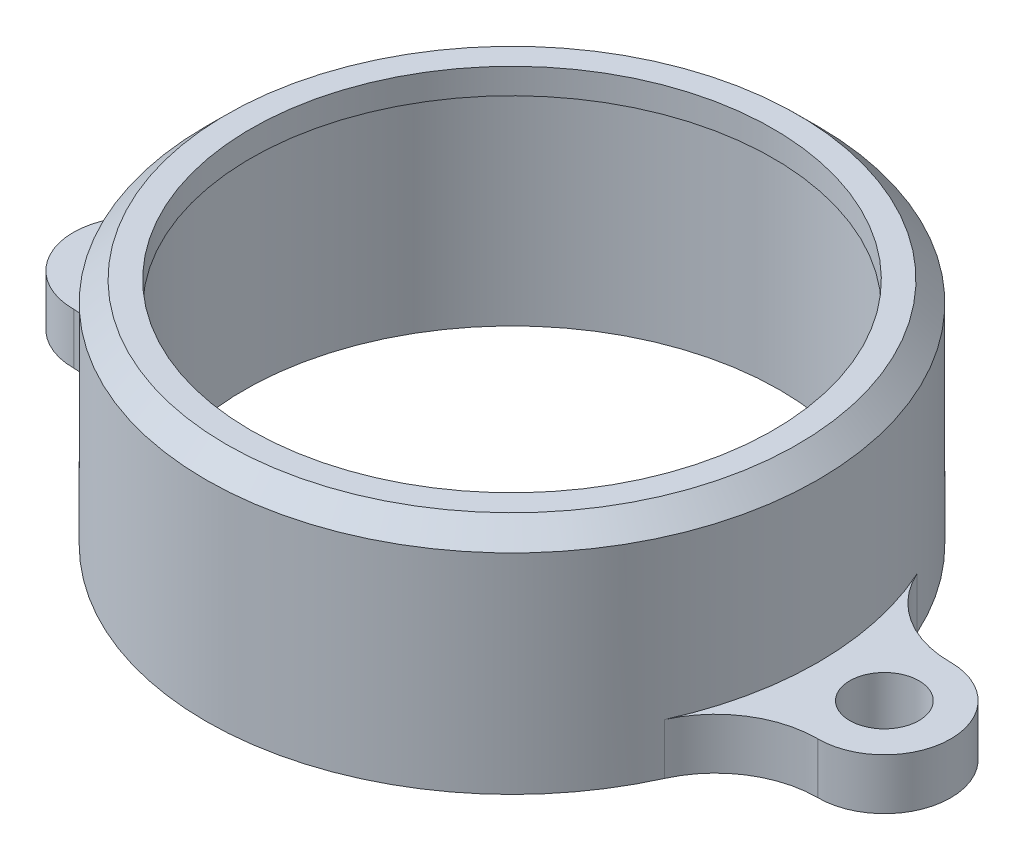
from build123d import *
from build123d.topology import SkipClean

# Parameters (mm, degrees)
SKETCH1_R             = 19.05
SKETCH1_R_2           = 16.256
BOSS_EXTRUDE1_DEPTH   = 1.5875
SKETCH2_R             = 19.05
SKETCH2_R_2           = 16.66875
BOSS_EXTRUDE2_DEPTH   = 9.525
CHAMFER1_SIZE         = 1.27
SKETCH3_R             = 16.66875
BOSS_EXTRUDE3_DEPTH   = 3.175
FILLET1_R             = 6.35
F_6_CLEARANCE_HOLE1_D = 4.3053


with BuildPart() as part:
    # Sketch1 → Boss-Extrude1 (new body)
    with BuildSketch(Plane(origin=(0, 0, 0), x_dir=(1, 0, 0), z_dir=(0, 1, 0))):
        with Locations(Location((0, 0, 0), (0, 0, 270))):
            Circle(SKETCH1_R)
        with Locations(Location((0, 0, 0), (0, 0, 270))):
            Circle(SKETCH1_R_2, mode=Mode.SUBTRACT)
    extrude(amount=-BOSS_EXTRUDE1_DEPTH)

    # Sketch2 → Boss-Extrude2 (add)
    with BuildSketch(Plane.XZ.offset(1.5875)):
        with Locations(Location((0, 0, 0), (0, 0, 90))):
            Circle(SKETCH2_R)
        with Locations(Location((0, 0, 0), (0, 0, 270))):
            Circle(SKETCH2_R_2, mode=Mode.SUBTRACT)
    extrude(amount=BOSS_EXTRUDE2_DEPTH)

    # Chamfer1
    chamfer1_edges = [part.edges().sort_by_distance(p)[0] for p in [
        (0, 0, -19.05),
    ]]
    chamfer(chamfer1_edges, length=CHAMFER1_SIZE)

    # Sketch3 → Boss-Extrude3 (add)
    with SkipClean():  # the faces are left unmerged after this step: merging them gives an invalid solid
        with BuildSketch(Plane.XZ.offset(11.1125)):
            with BuildLine():
                Line((-23.1775, 4.1275), (-18.5974795, 4.1275))
                ThreePointArc((-18.5974795, 4.1275), (0, 19.05), (18.5974795, 4.1275))
                Line((18.5974795, 4.1275), (23.1775, 4.1275))
                ThreePointArc((23.1775, 4.1275), (27.305, 0), (23.1775, -4.1275))
                Line((23.1775, -4.1275), (18.5974795, -4.1275))
                ThreePointArc((18.5974795, -4.1275), (0, -19.05), (-18.5974795, -4.1275))
                Line((-18.5974795, -4.1275), (-23.1775, -4.1275))
                ThreePointArc((-23.1775, -4.1275), (-27.305, 0), (-23.1775, 4.1275))
            make_face()
            with Locations(Location((0, 0, 0), (0, 0, 270))):
                Circle(SKETCH3_R, mode=Mode.SUBTRACT)
        extrude(amount=BOSS_EXTRUDE3_DEPTH)
    add(part.part.scale(1), mode=Mode.REPLACE)  # the faces are merged on a copy

    # Fillet1
    # the kernel refuses this fillet: 6.35 mm, written as the material it adds along each edge
    with BuildSketch(Plane(origin=(18.5974795, -11.1125, 4.1275), x_dir=(-0.3162725181456123, 0, 0.948668379501411), z_dir=(0, -1, 0)), Plane(origin=(-18.5974795, -11.1125, -4.1275), x_dir=(0.3162725181456131, 0, -0.9486683795014108), z_dir=(0, -1, 0))) as fillet1_piece_1:
        with BuildLine():
            CenterArc((4.587900184, -6.316085186), FILLET1_R, 95.924326289, 65.63802206)
            Line((-1.436144025, -4.307754696), (0, 0))
            ThreePointArc((0, 0), (1.966242936, -0.101744441), (3.932485872, 0))
        make_face()
    extrude(amount=3.175)
    with BuildSketch(Plane(origin=(-18.5974795, -11.1125, 4.1275), x_dir=(0.3162725181456136, 0, 0.9486683795014107), z_dir=(0, -1, 0)), Plane(origin=(18.5974795, -11.1125, -4.1275), x_dir=(-0.3162725181456148, 0, -0.9486683795014103), z_dir=(0, -1, 0))) as fillet1_piece_2:
        with BuildLine():
            CenterArc((4.587900184, 6.316085186), FILLET1_R, 198.437651651, 65.63802206)
            Line((-1.436144025, 4.307754696), (0, 0))
            ThreePointArc((0, 0), (1.966242936, 0.101744441), (3.932485872, 0))
        make_face()
    extrude(amount=3.175)

    # #6 Clearance Hole1 (through all)
    with Locations(Plane(origin=(0, -14.2875, 0), x_dir=(-1, 0, 0), z_dir=(0, -1, 0))):
        with Locations((-23.1775, 0), (23.1775, 0)):
            Hole(F_6_CLEARANCE_HOLE1_D / 2)


solid = part.part
